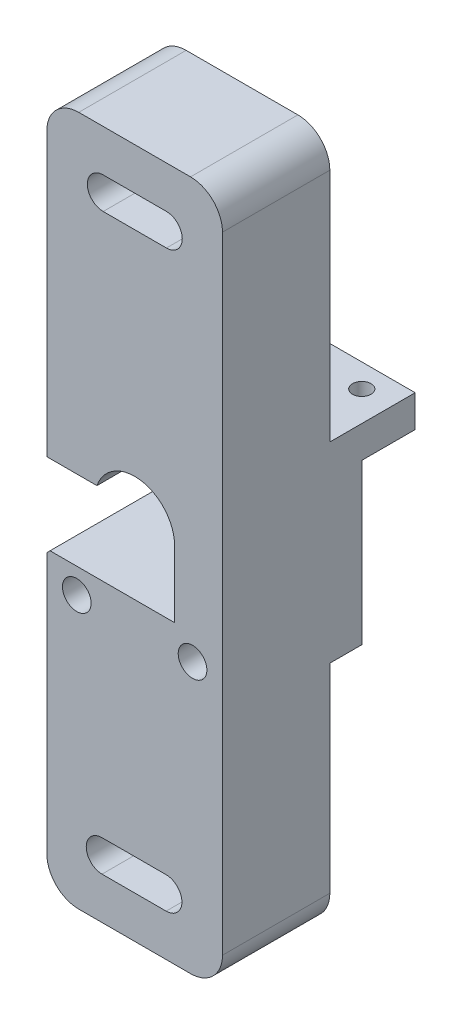
from build123d import *

# Parameters (mm, degrees)
BOSS_EXTRUDE1_DEPTH                                = 5.080000000000001
SKETCH2_W                                          = 5.079999999999998
SKETCH2_H                                          = 0.5079999999999831
BOSS_EXTRUDE2_DEPTH                                = 17.907000000000004
BOSS_EXTRUDE3_DEPTH                                = 1.9049999999999987
BOSS_EXTRUDE4_DEPTH                                = 17.779999999999998
SKETCH5_W                                          = 20.31999999999999
SKETCH5_H                                          = 22.859999999999992
BOSS_EXTRUDE5_DEPTH                                = 63.1505057547775
BOSS_EXTRUDE6_DEPTH                                = 10.03299999999999
BOSS_EXTRUDE7_DEPTH                                = 5.079999999999997
SKETCH8_W                                          = 22.859999999999992
SKETCH8_H                                          = 80.6430229523153
BOSS_EXTRUDE8_DEPTH                                = 7.619999999999997
CUT_EXTRUDE1_DEPTH                                 = 12.699999999999996
CUT_EXTRUDE2_DEPTH                                 = 12.699999999999998
BOSS_EXTRUDE9_DEPTH                                = 5.079999999999997
BOSS_EXTRUDE10_DEPTH                               = 62.23197704768469
SKETCH13_W                                         = 9.524999999999991
SKETCH13_H                                         = 12.699999999999998
CUT_EXTRUDE3_DEPTH                                 = 2.381494245222503
SKETCH14_W                                         = 17.779999999999994
SKETCH14_H                                         = 59.05499999999999
CUT_EXTRUDE4_DEPTH                                 = 100.64847640581364
SKETCH15_W                                         = 5.079999999999998
SKETCH15_H                                         = 53.339999999999996
CUT_EXTRUDE5_DEPTH                                 = 100.64847640581364
CUT_EXTRUDE6_DEPTH                                 = 93.34611808300336
CUT_EXTRUDE7_DEPTH                                 = 94.45724543875664
CUT_EXTRUDE8_DEPTH                                 = 93.34611808300336
CUT_EXTRUDE9_DEPTH                                 = 93.34611808300336
CBORE_FOR_M2_5_HEX_HEAD_MACHINE_SCREW1_D           = 2.9464
CBORE_FOR_M2_5_HEX_HEAD_MACHINE_SCREW1_DEPTH       = 22.86
CBORE_FOR_M2_5_HEX_HEAD_MACHINE_SCREW1_CBORE_D     = 5.55752
CBORE_FOR_M2_5_HEX_HEAD_MACHINE_SCREW1_CBORE_DEPTH = 2.8448
M2_5_CLEARANCE_HOLE1_D                             = 2.9464
M2_5_CLEARANCE_HOLE1_DEPTH                         = 83.82
M2_5_CLEARANCE_HOLE2_D                             = 2.9464
M2_5_CLEARANCE_HOLE2_DEPTH                         = 64.135
FILLET2_R                                          = 2.540000000000001
CHAMFER2_SIZE                                      = 0.938019803
FILLET3_R                                          = 5.079999999999999
BOSS_EXTRUDE16_DEPTH                               = 5.080000000000002
SKETCH33_W                                         = 27.93999999999999
SKETCH33_H                                         = 16.56944292798444
CUT_EXTRUDE10_DEPTH                                = 5.080000000000002
BOSS_EXTRUDE17_START                               = -5.080000000000002
BOSS_EXTRUDE17_DEPTH                               = 5.080000000000002
SKETCH35_W                                         = 27.940000000000005
SKETCH35_H                                         = 16.529374070210466
CUT_EXTRUDE11_DEPTH                                = 5.08
CUT_EXTRUDE12_DEPTH                                = 5.08
FILLET4_R                                          = 5.08
FILLET5_R                                          = 5.08
FILLET6_R                                          = 5.08
FILLET7_R                                          = 5.08
CUT_EXTRUDE13_DEPTH                                = 5.08
SKETCH39_W                                         = 27.940000000000005
SKETCH39_H                                         = 3.5882356704365357
CUT_EXTRUDE14_DEPTH                                = 7.492999999999999
SKETCH40_W                                         = 27.940000000000005
SKETCH40_H                                         = 0.6187251467707799
CUT_EXTRUDE15_DEPTH                                = 7.492999999999999
BOSS_EXTRUDE18_START                               = 12
SKETCH41_R                                         = 2.7787599999999943
BOSS_EXTRUDE18_DEPTH                               = 12
SKETCH42_R                                         = 2.7787599999999943
CUT_EXTRUDE16_DEPTH                                = 32.512
SKETCH43_R                                         = 2.7787599999999935
SKETCH43_R_2                                       = 2.2787599999999935
SKETCH43_R_3                                       = 2.7787599999999943
BOSS_EXTRUDE19_DEPTH                               = 22.16


with BuildPart() as part:
    # Sketch1 → Boss-Extrude1 (new body)
    with BuildSketch(Plane.XY.offset(33.654999999999994)):
        Polygon((-13.96999999999999, 9.810505754777516), (-13.461999999999998, 9.810505754777516), (-13.461999999999998, 10.3185057547775), align=None)
    extrude(amount=-BOSS_EXTRUDE1_DEPTH)

    # Sketch2 → Boss-Extrude2 (add)
    with BuildSketch(Plane(origin=(-13.461999999999998, 0, 0), x_dir=(0, 0, -1), z_dir=(1, 0, 0))):
        with Locations((-31.114999999999995, 10.064505754777507)):
            Rectangle(SKETCH2_W, SKETCH2_H)
    extrude(amount=BOSS_EXTRUDE2_DEPTH)

    # Sketch3 → Boss-Extrude3 (add)
    with BuildSketch(Plane(origin=(4.445000000000005, 0, 0), x_dir=(0, 0, -1), z_dir=(1, 0, 0))):
        Polygon((-28.574999999999996, 9.810505754777516), (-33.654999999999994, 9.810505754777516), (-33.654999999999994, 10.3185057547775), (-29.083000000000002, 10.3185057547775), (-28.574999999999996, 10.826505754777498), align=None)
    extrude(amount=BOSS_EXTRUDE3_DEPTH)

    # Sketch4 → Boss-Extrude4 (add)
    with BuildSketch(Plane(origin=(0, 0, 28.574999999999996), x_dir=(-1, 0, 0), z_dir=(0, 0, -1))):
        with BuildLine():
            Line((-6.3500000000000005, 9.810505754777516), (-6.349999999999998, 27.303022952315306))
            Line((-6.349999999999998, 27.303022952315306), (3.93700000000001, 27.303022952315306))
            Line((3.93700000000001, 27.303022952315306), (3.93700000000001, 23.0185057547775))
            ThreePointArc((3.93700000000001, 23.0185057547775), (-2.14e-15, 25.399999999999995), (-3.9370000000000167, 23.0185057547775))
            Line((-3.9370000000000167, 23.0185057547775), (-4.445000000000012, 23.0185057547775))
            Line((-4.445000000000012, 23.0185057547775), (-4.445000000000001, 10.3185057547775))
            Line((-4.445000000000001, 10.3185057547775), (13.46200000000004, 10.3185057547775))
            Line((13.46200000000004, 10.3185057547775), (13.969999999999992, 9.810505754777516))
            Line((13.969999999999992, 9.810505754777516), (-6.3500000000000005, 9.810505754777516))
        make_face()
    extrude(amount=BOSS_EXTRUDE4_DEPTH)

    # Sketch5 → Boss-Extrude5 (add)
    with BuildSketch(Plane.XZ.offset(-9.810505754777516)):
        with Locations((-3.8099999999999947, 22.224999999999998)):
            Rectangle(SKETCH5_W, SKETCH5_H)
    extrude(amount=BOSS_EXTRUDE5_DEPTH)

    # Sketch6 → Boss-Extrude6 (add)
    with BuildSketch(Plane.ZY.offset(3.93700000000001)):
        Polygon((28.575, 23.0185057547775), (10.795, 23.0185057547775), (10.794999999999998, 27.303022952315306), (28.575, 27.303022952315306), align=None)
    extrude(amount=BOSS_EXTRUDE6_DEPTH)

    # Sketch7 → Boss-Extrude7 (add)
    with BuildSketch(Plane.XY.offset(28.574999999999996)):
        with BuildLine():
            Line((0.15844430213195376, 27.303022952315306), (6.3500000000000005, 27.303022952315306))
            Line((6.3500000000000005, 27.303022952315306), (6.3500000000000005, 20.955000000000002))
            ThreePointArc((6.3500000000000005, 20.955000000000002), (4.545801432010527, 25.38875566994067), (0.15844430213195376, 27.303022952315306))
        make_face()
    extrude(amount=BOSS_EXTRUDE7_DEPTH)

    # Sketch8 → Boss-Extrude8 (add)
    with BuildSketch(Plane(origin=(6.350000000000003, 0, 0), x_dir=(0, 0, -1), z_dir=(1, 0, 0))):
        with Locations((-22.224999999999998, -13.018488523842345)):
            Rectangle(SKETCH8_W, SKETCH8_H)
    extrude(amount=BOSS_EXTRUDE8_DEPTH)

    # Sketch9 → Cut-Extrude1 (cut)
    with BuildSketch(Plane(origin=(0, 0, 10.794999999999998), x_dir=(-1, 0, 0), z_dir=(0, 0, -1))):
        Polygon((13.97, 25.4), (4.44500000000001, 25.4), (4.445000000000009, 23.526505754777506), (3.9369999999999985, 23.0185057547775), (13.97, 23.0185057547775), align=None)
    extrude(amount=-CUT_EXTRUDE1_DEPTH, mode=Mode.SUBTRACT)

    # Sketch10 → Cut-Extrude2 (cut)
    with BuildSketch(Plane(origin=(0, 0, 10.794999999999998), x_dir=(-1, 0, 0), z_dir=(0, 0, -1))):
        Polygon((-4.445000000000001, 10.3185057547775), (-4.44500000000001, 23.018505754777497), (-13.97, 23.018505754777497), (-13.97, -53.339999999999996), (13.969999999999992, -53.339999999999996), (13.970000000000004, 9.81050575477752), (13.46200000000004, 10.3185057547775), align=None)
    extrude(amount=-CUT_EXTRUDE2_DEPTH, mode=Mode.SUBTRACT)

    # Sketch11 → Boss-Extrude9 (add)
    with BuildSketch(Plane.XY.offset(28.574999999999996)):
        with BuildLine():
            Line((-6.005367932108752, 23.0185057547775), (-13.97, 23.0185057547775))
            Line((-13.97, 23.0185057547775), (-13.97, 27.303022952315306))
            Line((-13.97, 27.303022952315306), (-0.15844430213195376, 27.303022952315306))
            ThreePointArc((-0.15844430213195376, 27.303022952315306), (-3.7533208254481982, 26.077019404615417), (-6.005367932108752, 23.0185057547775))
        make_face()
    extrude(amount=BOSS_EXTRUDE9_DEPTH)

    # Sketch12 → Boss-Extrude10 (add)
    with BuildSketch(Plane(origin=(0, 27.303022952315306, 0), x_dir=(-1, 0, 0), z_dir=(0, 1, 0))):
        Polygon((-13.97, 33.654999999999994), (13.97, 33.654999999999994), (13.97, 10.794999999999998), (-13.97, 10.795), align=None)
    extrude(amount=BOSS_EXTRUDE10_DEPTH)

    # Sketch13 → Cut-Extrude3 (cut)
    with BuildSketch(Plane.XZ.offset(-23.0185057547775)):
        with Locations((9.207500000000005, 17.145)):
            Rectangle(SKETCH13_W, SKETCH13_H)
    extrude(amount=-CUT_EXTRUDE3_DEPTH, mode=Mode.SUBTRACT)

    # Sketch14 → Cut-Extrude4 (cut, through all)
    with BuildSketch(Plane(origin=(13.97, 0, 0), x_dir=(0, 0, -1), z_dir=(1, 0, 0))):
        with Locations((-19.685, 60.0075)):
            Rectangle(SKETCH14_W, SKETCH14_H)
    extrude(amount=-CUT_EXTRUDE4_DEPTH, mode=Mode.SUBTRACT)

    # Sketch15 → Cut-Extrude5 (cut, through all)
    with BuildSketch(Plane(origin=(13.97, 0, 0), x_dir=(0, 0, -1), z_dir=(1, 0, 0))):
        with Locations((-26.034999999999997, -26.669999999999998)):
            Rectangle(SKETCH15_W, SKETCH15_H)
    extrude(amount=-CUT_EXTRUDE5_DEPTH, mode=Mode.SUBTRACT)

    # Sketch16 → Cut-Extrude6 (cut, through all)
    with BuildSketch(Plane(origin=(0, 0, 28.575), x_dir=(-1, 0, 0), z_dir=(0, 0, -1))):
        with BuildLine():
            Line((5.08, -41.592499999999994), (-5.08, -41.592499999999994))
            ThreePointArc((-5.08, -41.592499999999994), (-7.620000000000006, -44.1325), (-5.08, -46.6725))
            Line((-5.08, -46.6725), (5.08, -46.6725))
            ThreePointArc((5.08, -46.6725), (7.619999999999999, -44.1325), (5.08, -41.592499999999994))
        make_face()
    extrude(amount=-CUT_EXTRUDE6_DEPTH, mode=Mode.SUBTRACT)

    # Sketch17 → Cut-Extrude7 (cut, through all)
    with BuildSketch(Plane.XY.offset(33.654999999999994)):
        with BuildLine():
            Line((-5.08, -38.4175), (5.08, -38.4175))
            ThreePointArc((5.08, -38.4175), (7.619999999999999, -35.8775), (5.08, -33.3375))
            Line((5.08, -33.3375), (-5.08, -33.3375))
            ThreePointArc((-5.08, -33.3375), (-7.619999999999999, -35.8775), (-5.08, -38.4175))
        make_face()
    extrude(amount=-CUT_EXTRUDE7_DEPTH, mode=Mode.SUBTRACT)

    # Sketch18 → Cut-Extrude8 (cut, through all)
    with BuildSketch(Plane(origin=(0, 0, 28.575), x_dir=(-1, 0, 0), z_dir=(0, 0, -1))):
        with BuildLine():
            Line((5.08, 73.9775), (-5.08, 73.9775))
            ThreePointArc((-5.08, 73.9775), (-7.620000000000006, 71.4375), (-5.08, 68.8975))
            Line((-5.08, 68.8975), (5.08, 68.8975))
            ThreePointArc((5.08, 68.8975), (7.620000000000006, 71.4375), (5.08, 73.9775))
        make_face()
    extrude(amount=-CUT_EXTRUDE8_DEPTH, mode=Mode.SUBTRACT)

    # Sketch19 → Cut-Extrude9 (cut, through all)
    with BuildSketch(Plane(origin=(0, 0, 28.575), x_dir=(-1, 0, 0), z_dir=(0, 0, -1))):
        with BuildLine():
            Line((5.08, 82.2325), (-5.08, 82.2325))
            ThreePointArc((-5.08, 82.2325), (-7.620000000000006, 79.6925), (-5.08, 77.1525))
            Line((-5.08, 77.1525), (5.08, 77.1525))
            ThreePointArc((5.08, 77.1525), (7.619999999999992, 79.6925), (5.08, 82.2325))
        make_face()
    extrude(amount=-CUT_EXTRUDE9_DEPTH, mode=Mode.SUBTRACT)

    # CBORE for M2.5 Hex Head Machine Screw1
    with Locations(Plane.XY.offset(33.654999999999994)):
        with Locations((9.2075, 6.35), (-9.2075, 6.35)):
            CounterBoreHole(CBORE_FOR_M2_5_HEX_HEAD_MACHINE_SCREW1_D / 2, CBORE_FOR_M2_5_HEX_HEAD_MACHINE_SCREW1_CBORE_D / 2, CBORE_FOR_M2_5_HEX_HEAD_MACHINE_SCREW1_CBORE_DEPTH, depth=CBORE_FOR_M2_5_HEX_HEAD_MACHINE_SCREW1_DEPTH)

    # M2.5 Clearance Hole1
    with Locations(Plane(origin=(0, 30.48, 0), x_dir=(1, 0, 0), z_dir=(0, 1, 0))):
        with Locations((9.2075, -18.7325)):
            Hole(M2_5_CLEARANCE_HOLE1_D / 2, depth=M2_5_CLEARANCE_HOLE1_DEPTH)

    # M2.5 Clearance Hole2
    with Locations(Plane(origin=(0, 25.4, 0), x_dir=(-1, 0, 0), z_dir=(0, -1, 0))):
        with Locations((9.2075, -18.7325)):
            Hole(M2_5_CLEARANCE_HOLE2_D / 2, depth=M2_5_CLEARANCE_HOLE2_DEPTH)

    # Fillet2
    fillet2_edges = [part.edges().sort_by_distance(p)[0] for p in [
        (4.445000000000004, 10.3185057547775, 26.289),
    ]]
    fillet(fillet2_edges, radius=FILLET2_R)

    # Chamfer2
    # the kernel refuses this chamfer: 0.938019803 mm, written as the material it adds along each edge
    with BuildSketch(Plane(origin=(3.44e-15, 20.955, 28.574999999999996), x_dir=(0.3476137543318691, 0.9376378180295966, 0), z_dir=(0.9376378180295966, -0.3476137543318691, 0))) as chamfer2_piece_1_section:
        Polygon((6.349999999999995 - CHAMFER2_SIZE, 0), (6.350000000000003, CHAMFER2_SIZE), (6.349999999999995, 0), align=None)
    chamfer2_piece_1 = revolve(axis=Axis((3.44e-15, 20.955, 28.574999999999996), (0, 0, 1)), revolution_arc=113.14940178409387, mode=Mode.PRIVATE)
    chamfer2_piece_1 = split(chamfer2_piece_1, bisect_by=Plane(origin=(-2.526546800118106, 23.0185057547775, 29.032255606191857), z_dir=(0, 1, 0)), keep=Keep.TOP, mode=Mode.PRIVATE)
    add(chamfer2_piece_1)
    with BuildSketch(Plane(origin=(6.350000000000003, 8.4142161862341, 28.574999999999996), x_dir=(0.027495876610586452, 0, 0.9996219169112966), z_dir=(-1.5e-16, 1, 0))) as chamfer2_piece_2:
        Polygon((CHAMFER2_SIZE * 0.999621916411, -CHAMFER2_SIZE * 0.0274958765968), (-CHAMFER2_SIZE * 0.0274958765968, -CHAMFER2_SIZE * 0.999621916411), (0, 0), align=None)
    extrude(amount=12.540783813765902)
    with BuildSketch(Plane(origin=(-2e-15, 20.955, 28.574999999999996), x_dir=(1, 5.6e-16, 0), z_dir=(5.6e-16, -1, 0))) as chamfer2_piece_3:
        Polygon((6.350000000000002 - CHAMFER2_SIZE, 0), (6.350000000000002, CHAMFER2_SIZE), (6.350000000000002, 0), align=None)
    revolve(axis=Axis((-2e-15, 20.955, 28.574999999999996), (0, 0, 1)), revolution_arc=110.34466934043498)

    # Fillet3
    fillet3_edges = [part.edges().sort_by_distance(p)[0] for p in [
        (13.97, -53.339999999999996, 31.114999999999995),
        (13.97, 89.535, 31.114999999999995),
        (-13.97, 89.535, 31.114999999999995),
        (-13.96999999999999, -53.33999999999998, 31.114999999999995),
    ]]
    fillet(fillet3_edges, radius=FILLET3_R)

    # Sketch31 → Boss-Extrude16 (add)
    with BuildSketch(Plane.XY.offset(33.654999999999994)):
        with BuildLine():
            Line((-5.079999999999973, -38.4175), (5.08, -38.4175))
            ThreePointArc((5.08, -38.4175), (7.620000000000003, -35.8775), (5.08, -33.3375))
            Line((5.08, -33.3375), (-5.08, -33.3375))
            ThreePointArc((-5.08, -33.3375), (-7.6199999999999966, -35.87750000000001), (-5.079999999999973, -38.4175))
        make_face()
    extrude(amount=-BOSS_EXTRUDE16_DEPTH)

    # Sketch33 → Cut-Extrude10 (cut)
    with BuildSketch(Plane.XY.offset(33.654999999999994)):
        with Locations((5.33e-15, -45.05527853600776)):
            Rectangle(SKETCH33_W, SKETCH33_H)
    extrude(amount=-CUT_EXTRUDE10_DEPTH, mode=Mode.SUBTRACT)

    # Sketch34 → Boss-Extrude17 (add)
    with BuildSketch(Plane.XY.offset(33.654999999999994).offset(BOSS_EXTRUDE17_START)):
        with BuildLine():
            Line((-5.08, 73.9775), (5.079999999999992, 73.9775))
            ThreePointArc((5.079999999999992, 73.9775), (7.620000000000014, 71.43750000000001), (5.080000000000028, 68.8975))
            Line((5.080000000000028, 68.8975), (-5.08, 68.8975))
            ThreePointArc((-5.08, 68.8975), (-7.620000000000005, 71.4375), (-5.08, 73.9775))
        make_face()
    extrude(amount=BOSS_EXTRUDE17_DEPTH)

    # Sketch35 → Cut-Extrude11 (cut)
    with BuildSketch(Plane.XY.offset(33.654999999999994)):
        with Locations((-1.78e-15, 81.27031296489477)):
            Rectangle(SKETCH35_W, SKETCH35_H)
    extrude(amount=-CUT_EXTRUDE11_DEPTH, mode=Mode.SUBTRACT)

    # Sketch37 → Cut-Extrude12 (cut)
    with BuildSketch(Plane.XY.offset(33.654999999999994)):
        with BuildLine():
            Line((5.053727927387616, 61.28536545923424), (-5.0057610573760645, 61.28536545923424))
            ThreePointArc((-5.0057610573760645, 61.28536545923424), (-7.525567786090294, 63.805172187948486), (-5.0057610573760645, 66.32497891666272))
            Line((-5.0057610573760645, 66.32497891666272), (5.053727927387616, 66.32497891666272))
            ThreePointArc((5.053727927387616, 66.32497891666272), (7.573534656101845, 63.805172187948486), (5.053727927387616, 61.28536545923424))
        make_face()
    extrude(amount=-CUT_EXTRUDE12_DEPTH, mode=Mode.SUBTRACT)

    # Fillet4
    fillet4_edges = [part.edges().sort_by_distance(p)[0] for p in [
        (13.97, 73.00562592978953, 31.114999999999995),
    ]]
    fillet(fillet4_edges, radius=FILLET4_R)

    # Fillet5
    fillet5_edges = [part.edges().sort_by_distance(p)[0] for p in [
        (-13.970000000000002, 73.00562592978953, 31.114999999999995),
    ]]
    fillet(fillet5_edges, radius=FILLET5_R)

    # Fillet6
    fillet6_edges = [part.edges().sort_by_distance(p)[0] for p in [
        (13.97, -36.77055707201554, 31.114999999999995),
    ]]
    fillet(fillet6_edges, radius=FILLET6_R)

    # Fillet7
    fillet7_edges = [part.edges().sort_by_distance(p)[0] for p in [
        (-13.96999999999999, -36.77055707201554, 31.114999999999995),
    ]]
    fillet(fillet7_edges, radius=FILLET7_R)

    # Sketch38 → Cut-Extrude13 (cut)
    with BuildSketch(Plane.XY.offset(33.654999999999994)):
        with BuildLine():
            Line((5.0095124991452185, -25.077337252068435), (-5.191462732995735, -25.077337252068435))
            ThreePointArc((-5.191462732995735, -25.077337252068435), (-7.701650355564446, -27.58752487463715), (-5.191462732995735, -30.09771249720587))
            Line((-5.191462732995735, -30.09771249720587), (5.0095124991452185, -30.09771249720587))
            ThreePointArc((5.0095124991452185, -30.09771249720587), (7.519700121713935, -27.58752487463715), (5.0095124991452185, -25.077337252068435))
        make_face()
    extrude(amount=-CUT_EXTRUDE13_DEPTH, mode=Mode.SUBTRACT)

    # Sketch39 → Cut-Extrude14 (cut)
    with BuildSketch(Plane(origin=(0, 30.48, 0), x_dir=(1, 0, 0), z_dir=(0, 1, 0))):
        with Locations((-2.66e-15, -12.589117835218268)):
            Rectangle(SKETCH39_W, SKETCH39_H)
    extrude(amount=-CUT_EXTRUDE14_DEPTH, mode=Mode.SUBTRACT)

    # Sketch40 → Cut-Extrude15 (cut)
    with BuildSketch(Plane(origin=(0, 30.48, 0), x_dir=(1, 0, 0), z_dir=(0, 1, 0))):
        with Locations((-2.66e-15, -14.692598243821926)):
            Rectangle(SKETCH40_W, SKETCH40_H)
    extrude(amount=-CUT_EXTRUDE15_DEPTH, mode=Mode.SUBTRACT)

    # Sketch41 → Boss-Extrude18 (add)
    with BuildSketch(Plane.XY.offset(33.654999999999994).offset(BOSS_EXTRUDE18_START)):
        with BuildLine():
            Line((-8.889999999999963, -36.77055707201554), (8.889999999999963, -36.77055707201554))
            ThreePointArc((8.889999999999963, -36.77055707201554), (12.48210244842766, -35.282659520443204), (13.97, -31.690557072015505))
            Line((13.97, -31.690557072015505), (13.97, 67.92562592978949))
            ThreePointArc((13.97, 67.92562592978949), (12.48210244842766, 71.51772837821719), (8.889999999999963, 73.00562592978953))
            Line((8.889999999999963, 73.00562592978953), (-8.889999999999963, 73.00562592978953))
            ThreePointArc((-8.889999999999963, 73.00562592978953), (-12.482102448427664, 71.51772837821719), (-13.97, 67.92562592978949))
            Line((-13.97, 67.92562592978949), (-13.97, 23.0185057547775))
            Line((-13.97, 23.0185057547775), (-6.005367932108752, 23.0185057547775))
            ThreePointArc((-6.005367932108752, 23.0185057547775), (1.26e-15, 27.30302295231531), (6.005367932108753, 23.0185057547775))
            ThreePointArc((6.005367932108753, 23.0185057547775), (6.26347602080808, 22.001081256735382), (6.350000000000003, 20.955000000000002))
            Line((6.350000000000003, 20.955000000000002), (6.350000000000003, 10.318505754777496))
            Line((6.350000000000003, 10.318505754777496), (1.9050000000000302, 10.318505754777497))
            Line((1.9050000000000302, 10.318505754777497), (-13.461999999999998, 10.3185057547775))
            Line((-13.461999999999998, 10.3185057547775), (-13.96999999999999, 9.810505754777516))
            Line((-13.96999999999999, 9.810505754777516), (-13.97, -31.690557072015505))
            ThreePointArc((-13.97, -31.690557072015505), (-12.48210244842766, -35.282659520443204), (-8.889999999999963, -36.77055707201554))
        make_face()
        with Locations((-9.2075, 6.35)):
            Circle(SKETCH41_R, mode=Mode.SUBTRACT)
        with Locations((9.2075, 6.35)):
            Circle(SKETCH41_R, mode=Mode.SUBTRACT)
        with BuildLine():
            Line((-5.0057610573760645, 66.32497891666272), (5.053727927387616, 66.32497891666272))
            ThreePointArc((5.053727927387616, 66.32497891666272), (7.573534656101845, 63.805172187948486), (5.053727927387616, 61.28536545923426))
            Line((5.053727927387616, 61.28536545923426), (-5.0057610573760645, 61.28536545923426))
            ThreePointArc((-5.0057610573760645, 61.28536545923426), (-7.525567786090294, 63.805172187948486), (-5.0057610573760645, 66.32497891666272))
        make_face(mode=Mode.SUBTRACT)
        with BuildLine():
            Line((5.0095124991452185, -30.09771249720587), (-5.191462732995739, -30.097712497205865))
            ThreePointArc((-5.191462732995739, -30.097712497205865), (-7.701650355564454, -27.58752487463715), (-5.191462732995739, -25.077337252068435))
            Line((-5.191462732995739, -25.077337252068435), (5.009512499145212, -25.077337252068435))
            ThreePointArc((5.009512499145212, -25.077337252068435), (7.519700121713934, -27.587524874637147), (5.0095124991452185, -30.09771249720587))
        make_face(mode=Mode.SUBTRACT)
    extrude(amount=-BOSS_EXTRUDE18_DEPTH)

    # Sketch42 → Cut-Extrude16 (cut)
    with BuildSketch(Plane.XY.offset(45.655)):
        with Locations((-9.2075, 6.35)):
            Circle(SKETCH42_R)
        with Locations((9.2075, 6.35)):
            Circle(SKETCH42_R)
    extrude(amount=-CUT_EXTRUDE16_DEPTH, mode=Mode.SUBTRACT)

    # Sketch43 → Boss-Extrude19 (add)
    # profile 1 of 2: a face of its own
    with BuildSketch(Plane.XY.offset(45.655)):
        with Locations((-9.2075, 6.35)):
            Circle(SKETCH43_R)
        with Locations((-9.2075, 6.35)):
            Circle(SKETCH43_R_2, mode=Mode.SUBTRACT)
    # profile 2 of 2: a face of its own
    with BuildSketch(Plane.XY.offset(45.655)):
        with Locations((9.2075, 6.35)):
            Circle(SKETCH43_R_3)
        with Locations((9.2075, 6.35)):
            Circle(SKETCH43_R_2, mode=Mode.SUBTRACT)
    extrude(amount=-BOSS_EXTRUDE19_DEPTH)


solid = part.part
